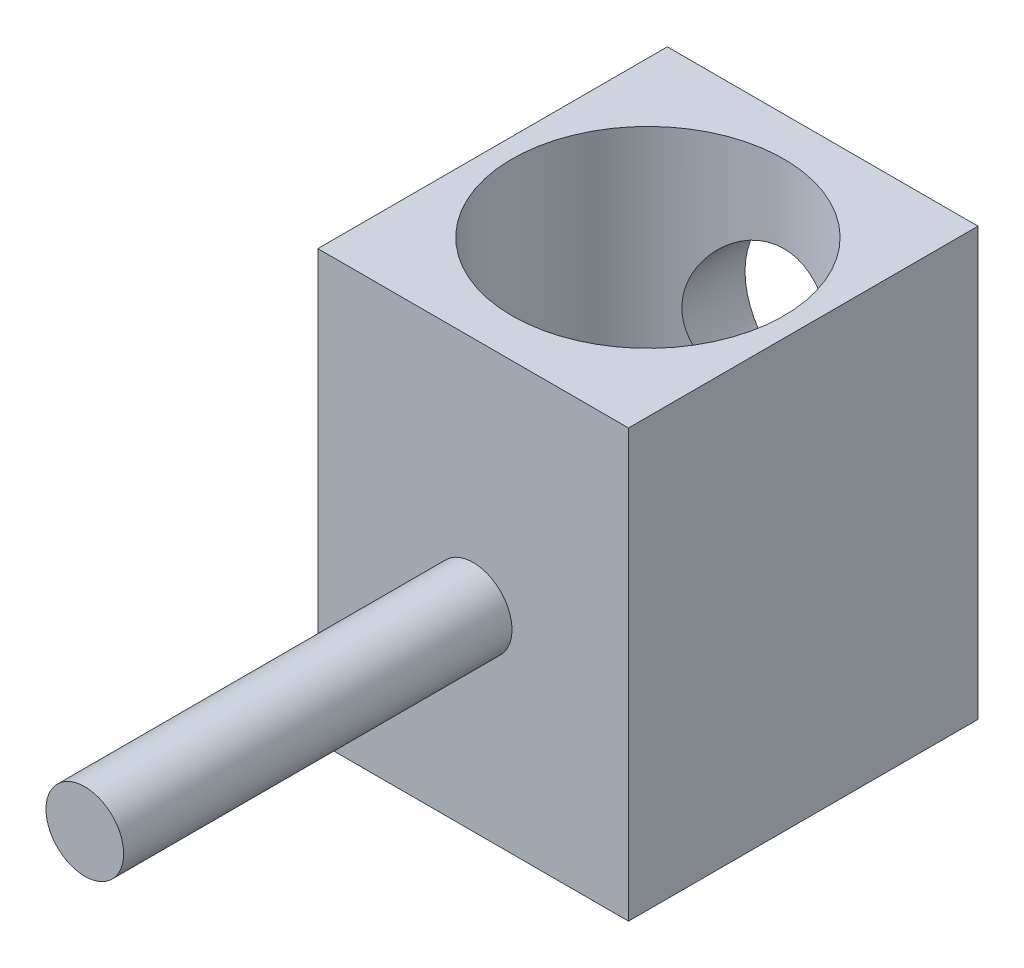
from build123d import *

# Parameters (mm, degrees)
SKETCH4_W           = 4
SKETCH4_H           = 4.5
BOSS_EXTRUDE1_DEPTH = 5.5
SKETCH5_R           = 0.5
BOSS_EXTRUDE2_DEPTH = 5
SKETCH6_R           = 1.75
CUT_EXTRUDE1_DEPTH  = 5
SKETCH7_R           = 1
CUT_EXTRUDE2_DEPTH  = 2


with BuildPart() as part:
    # Sketch4 → Boss-Extrude1 (new body)
    with BuildSketch(Plane(origin=(0, 0, 0), x_dir=(1, 0, 0), z_dir=(0, 1, 0))):
        Rectangle(SKETCH4_W, SKETCH4_H)
    extrude(amount=BOSS_EXTRUDE1_DEPTH)

    # Sketch5 → Boss-Extrude2 (add)
    with BuildSketch(Plane.XY.offset(2.25)):
        with Locations((0, 2.5)):
            Circle(SKETCH5_R)
    extrude(amount=BOSS_EXTRUDE2_DEPTH)

    # Sketch6 → Cut-Extrude1 (cut)
    with BuildSketch(Plane(origin=(0, 5.5, 0), x_dir=(1, 0, 0), z_dir=(0, 1, 0))):
        Circle(SKETCH6_R)
    extrude(amount=-CUT_EXTRUDE1_DEPTH, mode=Mode.SUBTRACT)

    # Sketch7 → Cut-Extrude2 (cut)
    with BuildSketch(Plane(origin=(0, 0, -2.25), x_dir=(-1, 0, 0), z_dir=(0, 0, -1))):
        with Locations((0, 3.5)):
            Circle(SKETCH7_R)
    extrude(amount=-CUT_EXTRUDE2_DEPTH, mode=Mode.SUBTRACT)


solid = part.part
